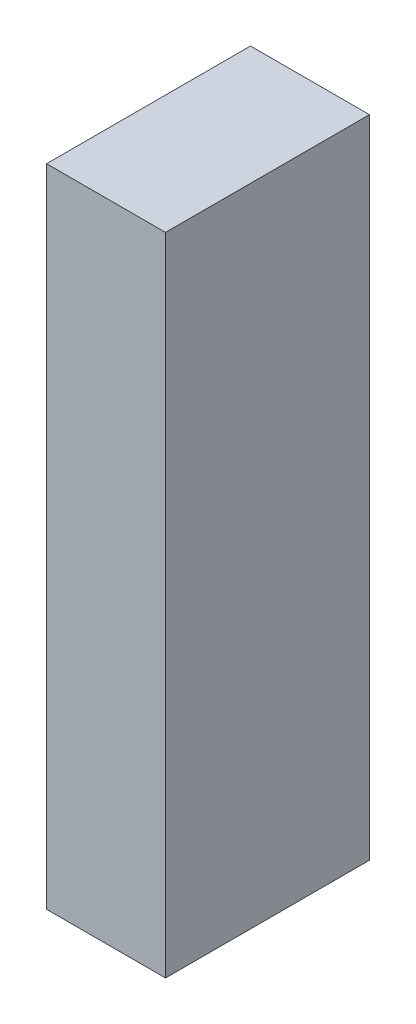
from build123d import *

# Parameters (mm, degrees)
SKETCH1_W           = 48
SKETCH1_H           = 152
BOSS_EXTRUDE1_DEPTH = 28


with BuildPart() as part:
    # Sketch1 → Boss-Extrude1 (new body)
    with BuildSketch(Plane(origin=(0, 0, 0), x_dir=(0, 0, -1), z_dir=(1, 0, 0))):
        Rectangle(SKETCH1_W, SKETCH1_H)
    extrude(amount=BOSS_EXTRUDE1_DEPTH)


solid = part.part
